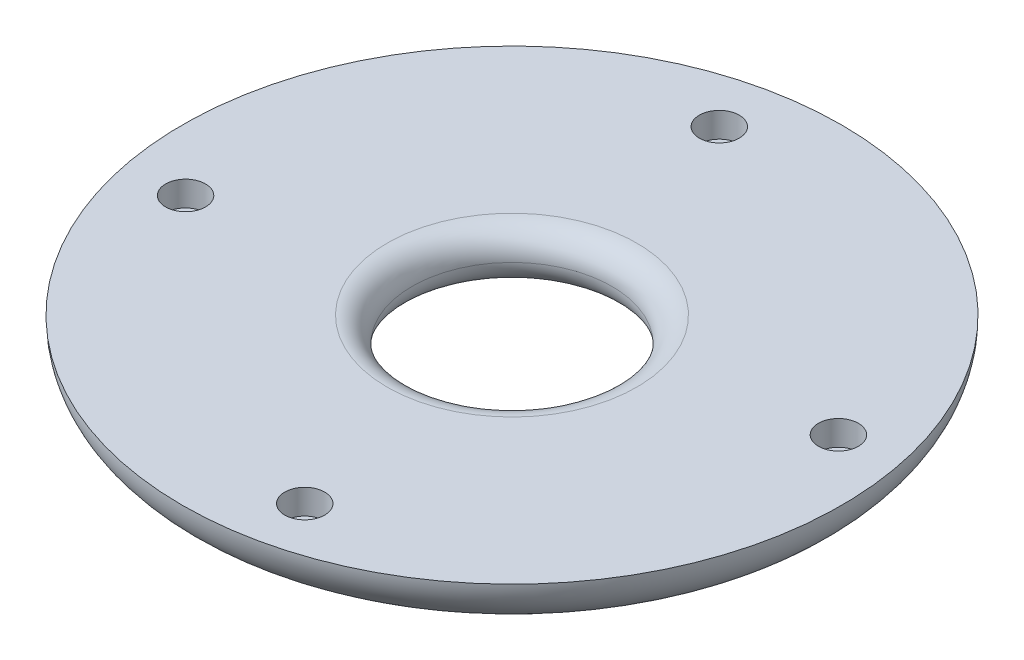
from build123d import *

# Parameters (mm, degrees)
SKETCH1_R           = 33
BOSS_EXTRUDE1_DEPTH = 5
SKETCH2_R           = 2
CUT_EXTRUDE1_DEPTH  = 2.5
FILLET1_R           = 5
SKETCH3_W           = 4
SKETCH3_H           = 5
SKETCH3_W_2         = 5
SKETCH3_H_2         = 4
BOSS_EXTRUDE2_DEPTH = 5
FILLET2_R           = 2.5
SKETCH4_R           = 1
CUT_EXTRUDE2_DEPTH  = 5
SKETCH5_R           = 1
CUT_EXTRUDE3_DEPTH  = 5
SKETCH6_R           = 10
CUT_EXTRUDE4_DEPTH  = 5
FILLET3_R           = 2.5


with BuildPart() as part:
    # Sketch1 → Boss-Extrude1 (new body)
    with BuildSketch(Plane(origin=(0, 0, 0), x_dir=(1, 0, 0), z_dir=(0, 1, 0))):
        with Locations(Location((0, 0, 0), (0, 0, 270))):
            Circle(SKETCH1_R)
    extrude(amount=BOSS_EXTRUDE1_DEPTH)

    # Sketch2 → Cut-Extrude1 (cut)
    with BuildSketch(Plane(origin=(0, 5, 0), x_dir=(1, 0, 0), z_dir=(0, 1, 0))):
        with Locations(Location((-26.719955328, -5.965376271, 0), (0, 0, 270))):
            Circle(SKETCH2_R)
        with Locations(Location((-5.965376271, 26.719955328, 0), (0, 0, 270))):
            Circle(SKETCH2_R)
        with Locations(Location((26.719955328, 5.965376271, 0), (0, 0, 270))):
            Circle(SKETCH2_R)
        with Locations(Location((5.965376271, -26.719955328, 0), (0, 0, 270))):
            Circle(SKETCH2_R)
    extrude(amount=-CUT_EXTRUDE1_DEPTH, mode=Mode.SUBTRACT)

    # Fillet1
    fillet1_edges = [part.edges().sort_by_distance(p)[0] for p in [
        (0, 0, -33),
    ]]
    fillet(fillet1_edges, radius=FILLET1_R - 0.0001)  # a hair under: the kernel refuses the full size

    # Sketch3 → Boss-Extrude2 (add)
    with BuildSketch(Plane.XZ):
        with Locations((0, 22.5)):
            Rectangle(SKETCH3_W, SKETCH3_H)
        with Locations((-22.5, 0)):
            Rectangle(SKETCH3_W_2, SKETCH3_H_2)
        with Locations((22.5, 0)):
            Rectangle(SKETCH3_W_2, SKETCH3_H_2)
        with Locations((0, -22.5)):
            Rectangle(SKETCH3_W, SKETCH3_H)
    extrude(amount=BOSS_EXTRUDE2_DEPTH)

    # Fillet2
    fillet2_edges = [part.edges().sort_by_distance(p)[0] for p in [
        (0, -5, 20),
        (0, -5, 25),
        (25, -5, 0),
        (20, -5, 0),
        (0, -5, -20),
        (0, -5, -25),
        (-25, -5, 0),
        (-20, -5, 0),
    ]]
    fillet(fillet2_edges, radius=FILLET2_R - 0.0001)  # a hair under: the kernel refuses the full size

    # Sketch4 → Cut-Extrude2 (cut)
    with BuildSketch(Plane(origin=(0, 0, -2), x_dir=(-1, 0, 0), z_dir=(0, 0, -1))):
        with Locations((22.5, -2.5)):
            Circle(SKETCH4_R)
        with Locations((-22.354219449, -2.5)):
            Circle(SKETCH4_R)
    extrude(amount=-CUT_EXTRUDE2_DEPTH, mode=Mode.SUBTRACT)

    # Sketch5 → Cut-Extrude3 (cut)
    with BuildSketch(Plane.ZY.offset(2)):
        with Locations((22.5, -2.5)):
            Circle(SKETCH5_R)
        with Locations((-22.5, -2.5)):
            Circle(SKETCH5_R)
    extrude(amount=-CUT_EXTRUDE3_DEPTH, mode=Mode.SUBTRACT)

    # Sketch6 → Cut-Extrude4 (cut)
    with BuildSketch(Plane.XZ):
        with Locations(Location((0, 0, 0), (0, 0, 270))):
            Circle(SKETCH6_R)
    extrude(amount=-CUT_EXTRUDE4_DEPTH, mode=Mode.SUBTRACT)

    # Fillet3
    fillet3_edges = [part.edges().sort_by_distance(p)[0] for p in [
        (0, 5, 10),
        (0, 0, 10),
    ]]
    fillet(fillet3_edges, radius=FILLET3_R - 0.0001)  # a hair under: the kernel refuses the full size


solid = part.part
